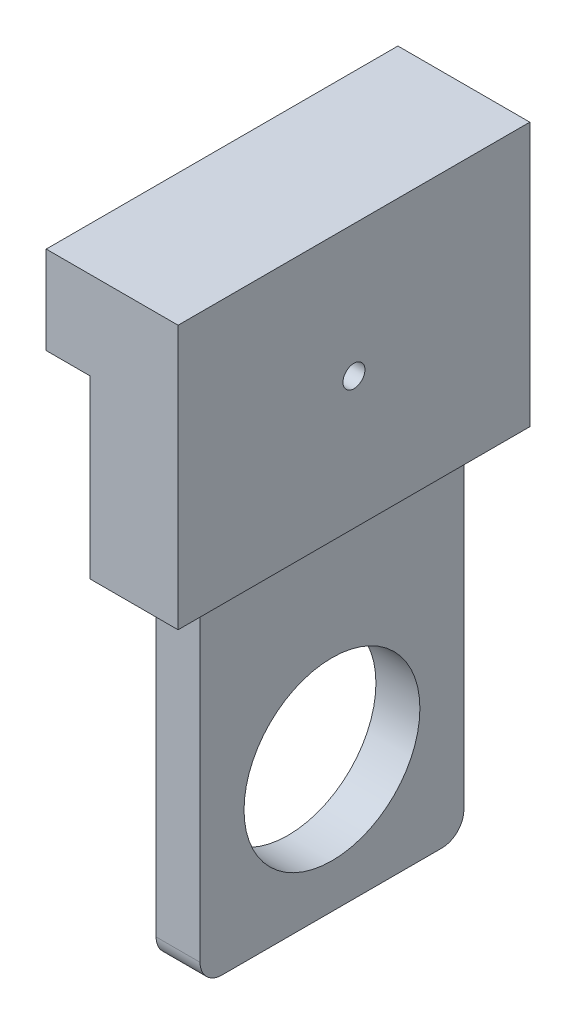
from build123d import *

# Parameters (mm, degrees)
SZKIC1_W                    = 1
SZKIC1_H                    = 4
DODANIE_WYCI_GNI_CIE1_DEPTH = 3
SZKIC4_W                    = 0.5
SZKIC4_H                    = 3
DODANIE_WYCI_GNI_CIE3_DEPTH = 3.9
SZKIC5_R                    = 1
WYTNIJ_WYCI_GNI_CIE2_DEPTH  = 3.9
ZAOKR_GLENIE1_R             = 0.25
SZKIC8_W                    = 4
SZKIC8_H                    = 1
DODANIE_WYCI_GNI_CIE4_DEPTH = 0.5
SZKIC9_R                    = 0.125
WYTNIJ_WYCI_GNI_CIE3_DEPTH  = 1


with BuildPart() as part:
    # Szkic1 → Dodanie-wyciągnięcie1 (new body)
    with BuildSketch(Plane(origin=(0, 0, 0), x_dir=(1, 0, 0), z_dir=(0, 1, 0))):
        Rectangle(SZKIC1_W, SZKIC1_H)
    extrude(amount=DODANIE_WYCI_GNI_CIE1_DEPTH)

    # Szkic4 → Dodanie-wyciągnięcie3 (add)
    with BuildSketch(Plane.XZ):
        Rectangle(SZKIC4_W, SZKIC4_H)
    extrude(amount=DODANIE_WYCI_GNI_CIE3_DEPTH)

    # Szkic5 → Wytnij-wyciągnięcie2 (cut)
    with BuildSketch(Plane(origin=(0.25, 0, 0), x_dir=(0, 0, -1), z_dir=(1, 0, 0))):
        with Locations((0, -2.4)):
            Circle(SZKIC5_R)
    extrude(amount=-WYTNIJ_WYCI_GNI_CIE2_DEPTH, mode=Mode.SUBTRACT)

    # Zaokrąglenie1
    zaokr_glenie1_edges = [part.edges().sort_by_distance(p)[0] for p in [
        (0.25, 0, 0),
        (0, 0, 1.5),
        (-0.25, 0, 0),
        (0, 0, -1.5),
        (0, -3.9, 1.5),
        (0, -3.9, -1.5),
    ]]
    fillet(zaokr_glenie1_edges, radius=ZAOKR_GLENIE1_R - 0.0001)  # a hair under: the kernel refuses the full size

    # Szkic8 → Dodanie-wyciągnięcie4 (add)
    with BuildSketch(Plane.ZY.offset(0.5)):
        with Locations((0, 2.5)):
            Rectangle(SZKIC8_W, SZKIC8_H)
    extrude(amount=DODANIE_WYCI_GNI_CIE4_DEPTH)

    # Szkic9 → Wytnij-wyciągnięcie3 (cut)
    with BuildSketch(Plane(origin=(0.5, 0, 0), x_dir=(0, 0, -1), z_dir=(1, 0, 0))):
        with Locations((0, 1.5)):
            Circle(SZKIC9_R)
    extrude(amount=-WYTNIJ_WYCI_GNI_CIE3_DEPTH, mode=Mode.SUBTRACT)


solid = part.part
